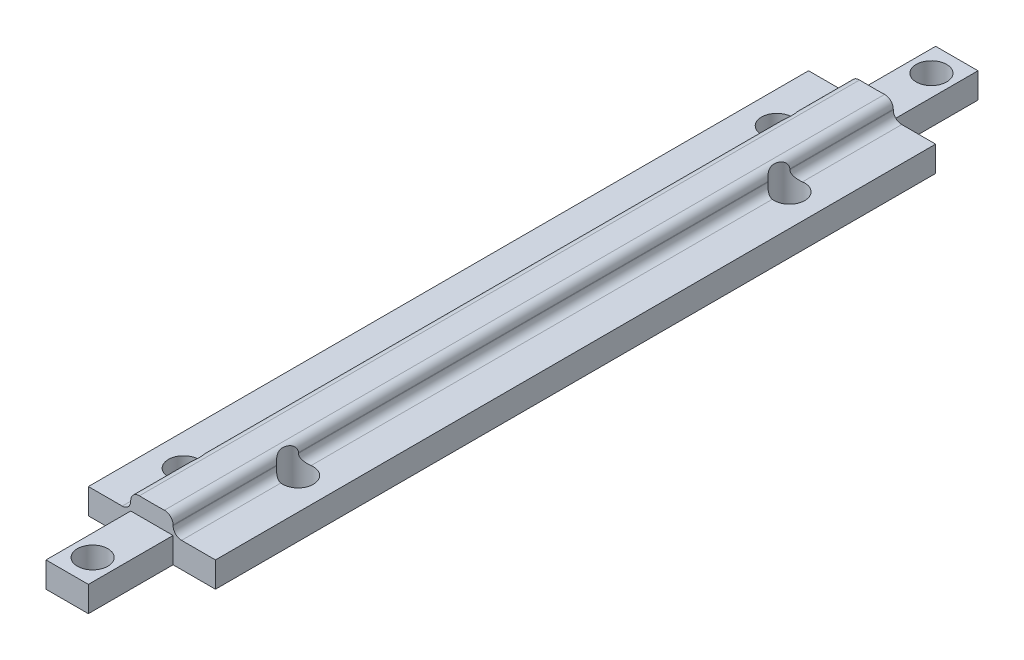
from build123d import *

# Parameters (mm, degrees)
SKETCH1_W               = 5
SKETCH1_H               = 85
BOSS_EXTRUDE1_DEPTH     = 3
BOSS_EXTRUDE2_DEPTH     = 42.5
BOSS_EXTRUDE3_START     = 42.5
BOSS_EXTRUDE3_DEPTH     = 42.5
SKETCH8_W               = 5
SKETCH8_H               = 10
BOSS_EXTRUDE4_DEPTH     = 3
SKETCH6_R               = 1.8
CUT_EXTRUDE1_DEPTH      = 53.645037753
SKETCH9_W               = 15
SKETCH9_H               = 85
BOSS_EXTRUDE5_DEPTH     = 3
FILLET1_R               = 1
CUT_EXTRUDE2_DEPTH      = 54.117793629
CUT_EXTRUDE2_DEPTH_BACK = 54.117793629
SKETCH10_R              = 1.8


with BuildPart() as part:
    # Sketch1 → Boss-Extrude1 (new body)
    with BuildSketch(Plane(origin=(0, 0, 0), x_dir=(1, 0, 0), z_dir=(0, 1, 0))):
        Rectangle(SKETCH1_W, SKETCH1_H)
    extrude(amount=BOSS_EXTRUDE1_DEPTH)

    # Sketch3 → Boss-Extrude2 (add)
    with BuildSketch(Plane.XY):
        with BuildLine():
            Line((-2.5, 3), (-2.5, 5.102989898))
            ThreePointArc((-2.5, 5.102989898), (0, 5.05), (2.5, 5.102989898))
            Line((2.5, 5.102989898), (2.5, 3))
            Line((2.5, 3), (2.5, 0))
            Line((2.5, 0), (-2.5, 0))
            Line((-2.5, 0), (-2.5, 3))
        make_face()
    extrude(amount=BOSS_EXTRUDE2_DEPTH)

    # Sketch7 → Boss-Extrude3 (add)
    with BuildSketch(Plane(origin=(0, 0, 0), x_dir=(-1, 0, 0), z_dir=(0, 0, -1)).offset(BOSS_EXTRUDE3_START)):
        with BuildLine():
            Line((-2.5, 5.102989898), (-2.5, 3))
            Line((-2.5, 3), (2.5, 3))
            Line((2.5, 3), (2.5, 5.102989898))
            ThreePointArc((2.5, 5.102989898), (0, 5.05), (-2.5, 5.102989898))
        make_face()
    extrude(amount=-BOSS_EXTRUDE3_DEPTH)

    # Sketch8 → Boss-Extrude4 (add)
    with BuildSketch(Plane.XZ):
        with Locations((0, 47.5)):
            Rectangle(SKETCH8_W, SKETCH8_H)
        with Locations((0, -47.5)):
            Rectangle(SKETCH8_W, SKETCH8_H)
    extrude(amount=-BOSS_EXTRUDE4_DEPTH)

    # Sketch6 → Cut-Extrude1 (cut, through all)
    with BuildSketch(Plane(origin=(0, 3, 0), x_dir=(1, 0, 0), z_dir=(0, 1, 0))):
        with Locations(Location((0, -49.5, 0), (0, 0, 270))):
            Circle(SKETCH6_R)
        with Locations(Location((0, 49.5, 0), (0, 0, 90))):
            Circle(SKETCH6_R)
    extrude(amount=-CUT_EXTRUDE1_DEPTH, mode=Mode.SUBTRACT)

    # Sketch9 → Boss-Extrude5 (add)
    with BuildSketch(Plane.XZ):
        Rectangle(SKETCH9_W, SKETCH9_H)
    extrude(amount=-BOSS_EXTRUDE5_DEPTH)

    # Fillet1
    # the kernel refuses this fillet: 1 mm, written as the material it adds along each edge
    with BuildSketch(Plane(origin=(2.5, 3, -42.5), x_dir=(0, 1, 0), z_dir=(0, 0, 1)), Plane(origin=(-2.5, 3, 42.5), x_dir=(0, 1, 0), z_dir=(0, 0, -1))) as fillet1_piece_1:
        with BuildLine():
            CenterArc((FILLET1_R, -FILLET1_R), FILLET1_R, 90, 90)
            Line((0, -FILLET1_R), (0, 0))
            Line((0, 0), (FILLET1_R, 0))
        make_face()
    extrude(amount=85)
    # the kernel refuses this fillet: 1 mm, written as the material it takes off along each edge
    with BuildSketch(Plane(origin=(-2.5, 5.102989898, 45.085592418), x_dir=(0, -1, 0), z_dir=(0, 0, -1))) as fillet1_2_piece_1:
        with BuildLine():
            CenterArc((1.034236967, -1), FILLET1_R, 90, 91.432543738)
            ThreePointArc((0.034549516, -1.025), (0.019501965, -0.512424928), (0, 0))
            Line((0, 0), (1.034236967, 0))
        make_face()
    extrude(amount=90.171184836, mode=Mode.SUBTRACT)
    with BuildSketch(Plane(origin=(2.5, 5.102989898, 45.085592418), x_dir=(0, -1, 0), z_dir=(0, 0, -1))) as fillet1_2_piece_2:
        with BuildLine():
            CenterArc((1.034236967, 1), FILLET1_R, 178.567456262, 91.432543738)
            ThreePointArc((0.034549516, 1.025), (0.019501965, 0.512424928), (0, 0))
            Line((0, 0), (1.034236967, 0))
        make_face()
    extrude(amount=90.171184836, mode=Mode.SUBTRACT)

    # Sketch10 → Cut-Extrude2 (cut, two sides: drawn at the far end of the back side and taken through both)
    with BuildSketch(Plane(origin=(0, 3, 0), x_dir=(1, 0, 0), z_dir=(0, 1, 0)).offset(-CUT_EXTRUDE2_DEPTH_BACK)):
        with Locations(Location((-3.75, -35, 0), (0, 0, 270))):
            Circle(SKETCH10_R)
        with Locations(Location((3.75, -29, 0), (0, 0, 270))):
            Circle(SKETCH10_R)
        with Locations(Location((3.75, 29, 0), (0, 0, 262.016443854))):
            Circle(SKETCH10_R)
        with Locations(Location((-3.75, 35, 0), (0, 0, 277.983556156))):
            Circle(SKETCH10_R)
    extrude(amount=CUT_EXTRUDE2_DEPTH + CUT_EXTRUDE2_DEPTH_BACK, mode=Mode.SUBTRACT)


solid = part.part
